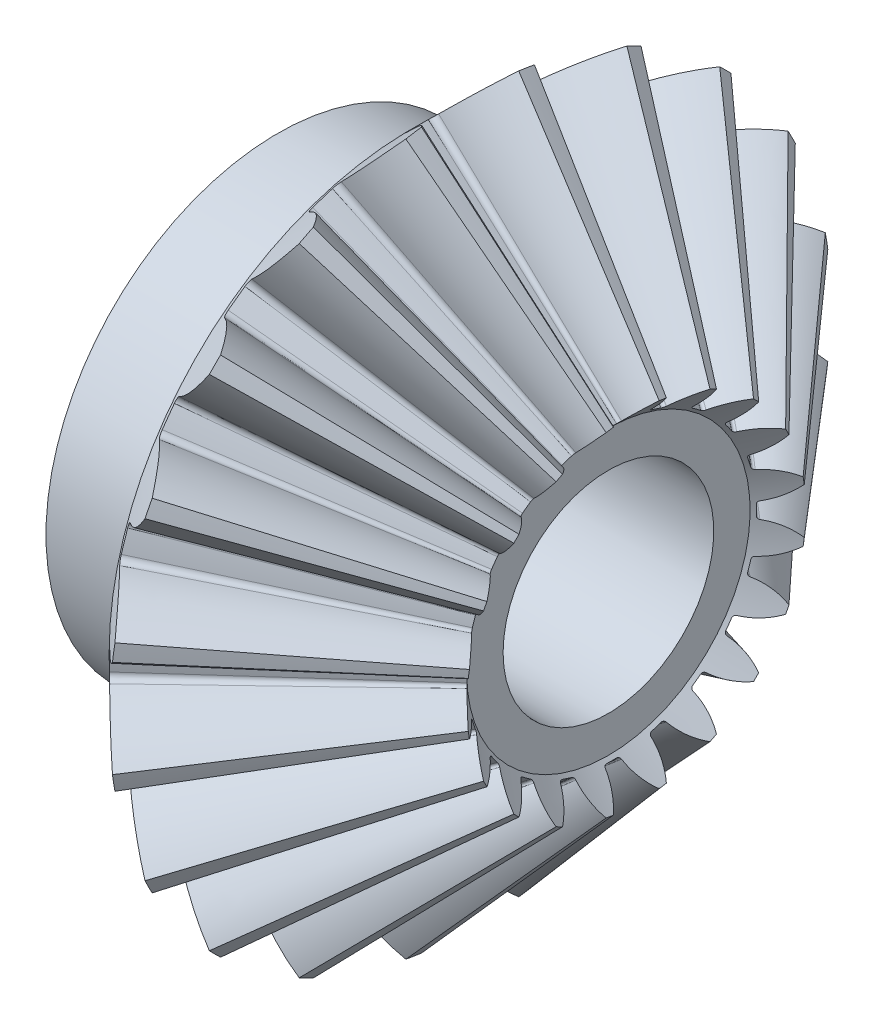
from build123d import *

# Parameters (mm, degrees)
TEETHCUTS_COUNT = 20
TEETHCUTS_ANGLE = 342
HUBSKE_R        = 5.5
HUB_DEPTH       = 3.15917486
BORSKE_R        = 2.5
BORE_DEPTH      = 12.0000508


with BuildPart() as part:
    # BasProSke → Base-Revolve (revolve)
    with BuildSketch(Plane(origin=(0, 0, 0), x_dir=(1, 0, 0), z_dir=(0, 1, 0)), mode=Mode.PRIVATE) as base_revolve_sk:
        Polygon((0, 0), (0, 7.159073261), (1.406612166, 8.565685424), (5.349252849, 4.023044734), (4.688609434, 3.36240132), (4.688609434, 0), align=None)
    revolve(base_revolve_sk.sketch.rotate(Axis((-10, 0, 0), (1, 0, 0)), 180), axis=Axis((-10, 0, 0), (1, 0, 0)))

    # ToothCut: read off the stored shape, not the designer's step
    # ToothCut: loft between two sections, ruled curve by curve
    toothcut_from = [
        Edge.make_bspline([(8.846968182, 0.006041442, -0.009396371), (8.842747294, 0.001820554, -0.014824058), (8.837070599, -0.003856141, -0.014022911), (8.833691402, -0.007235338, -0.007522631)], [0, 0, 0, 0, 1, 1, 1, 1], 3, [1, 0.779607321, 0.779607321, 1]),
        Edge.make_bspline([(8.833691402, -0.007235338, 0.007522631), (8.837070599, -0.003856141, 0.014022911), (8.842747294, 0.001820554, 0.014824058), (8.846968182, 0.006041442, 0.009396371)], [0, 0, 0, 0, 1, 1, 1, 1], 3, [1, 0.779607321, 0.779607321, 1]),
        Edge.make_bspline([(8.833691402, -0.007235338, -0.007522631), (8.833188772, -0.007737968, -0.006555763), (8.832787408, -0.008139332, -0.005498444), (8.832495307, -0.008431433, -0.00437174)], [0, 0, 0, 0, 1, 1, 1, 1], 3, [1, 0.993359051, 0.993359051, 1]),
        Edge.make_bspline([(8.832495307, -0.008431433, 0.00437174), (8.832787408, -0.008139332, 0.005498444), (8.833188772, -0.007737968, 0.006555763), (8.833691402, -0.007235338, 0.007522631)], [0, 0, 0, 0, 1, 1, 1, 1], 3, [1, 0.993359051, 0.993359051, 1]),
        Edge.make_bspline([(8.832495307, -0.008431433, -0.00437174), (8.831755763, -0.009170977, -0.001519142), (8.831755763, -0.009170977, 0.001519142), (8.832495307, -0.008431433, 0.00437174)], [0, 0, 0, 0, 1, 1, 1, 1], 3, [1, 0.959256539, 0.959256539, 1]),
        Edge.make_line((8.846968182, 0.006041442, 0.009396371), (8.846968182, 0.006041442, -0.009396371)),
    ]
    toothcut_to = [
        Edge.make_bspline([(1.46556069, 8.624633948, -1.28623016), (1.133128031, 8.29220129, -0.817842922), (0.716323315, 7.875396575, -0.512954078), (0.25391972, 7.412992981, -0.399925851)], [0, 0, 0, 0, 1, 1, 1, 1], 3, [1, 0.968991732, 0.968991732, 1]),
        Edge.make_bspline([(0.25391972, 7.412992981, 0.399925851), (0.716323315, 7.875396575, 0.512954078), (1.133128031, 8.29220129, 0.817842922), (1.46556069, 8.624633948, 1.28623016)], [0, 0, 0, 0, 1, 1, 1, 1], 3, [1, 0.968991732, 0.968991732, 1]),
        Edge.make_bspline([(0.25391972, 7.412992981, -0.399925851), (0.198607772, 7.357681033, -0.386405603), (0.16320738, 7.322280641, -0.324800046), (0.165162164, 7.324235425, -0.245465452)], [0, 0, 0, 0, 1, 1, 1, 1], 3, [1, 0.835749277, 0.835749277, 1]),
        Edge.make_bspline([(0.165162164, 7.324235425, 0.245465452), (0.16320738, 7.322280641, 0.324800046), (0.198607772, 7.357681033, 0.386405603), (0.25391972, 7.412992981, 0.399925851)], [0, 0, 0, 0, 1, 1, 1, 1], 3, [1, 0.835749277, 0.835749277, 1]),
        Edge.make_bspline([(0.165162164, 7.324235425, -0.245465452), (0.169193484, 7.328266745, -0.081854918), (0.169193484, 7.328266745, 0.081854918), (0.165162164, 7.324235425, 0.245465452)], [0, 0, 0, 0, 1, 1, 1, 1], 3, [1, 0.999595624, 0.999595624, 1]),
        Edge.make_line((1.46556069, 8.624633948, 1.28623016), (1.46556069, 8.624633948, -1.28623016)),
    ]
    toothcut = Solid(Shell([*[Face.make_surface_from_curves(toothcut_from[k], toothcut_to[k]) for k in range(6)], Face(Wire(toothcut_from)), Face(Wire(toothcut_to))]))
    add(toothcut, mode=Mode.SUBTRACT)

    # TeethCuts: ToothCut ×20 about axis
    teethcuts_axis = Axis((-10, 0, 0), (1, 0, 0))
    for i in range(1, TEETHCUTS_COUNT):
        add(toothcut.rotate(teethcuts_axis, i * TEETHCUTS_ANGLE / (TEETHCUTS_COUNT - 1)), mode=Mode.SUBTRACT)

    # HubSke → Hub (add)
    with BuildSketch(Plane.ZY):
        with Locations(Location((0, 0, 0), (0, 0, 180))):
            Circle(HUBSKE_R)
    extrude(amount=HUB_DEPTH)

    # BorSke → Bore (cut, symmetric)
    with BuildSketch(Plane(origin=(0, 0, 0), x_dir=(0, 0, -1), z_dir=(1, 0, 0))):
        with Locations(Location((0, 0, 0), (0, 0, 180))):
            Circle(BORSKE_R)
    extrude(amount=BORE_DEPTH, both=True, mode=Mode.SUBTRACT)


solid = part.part
